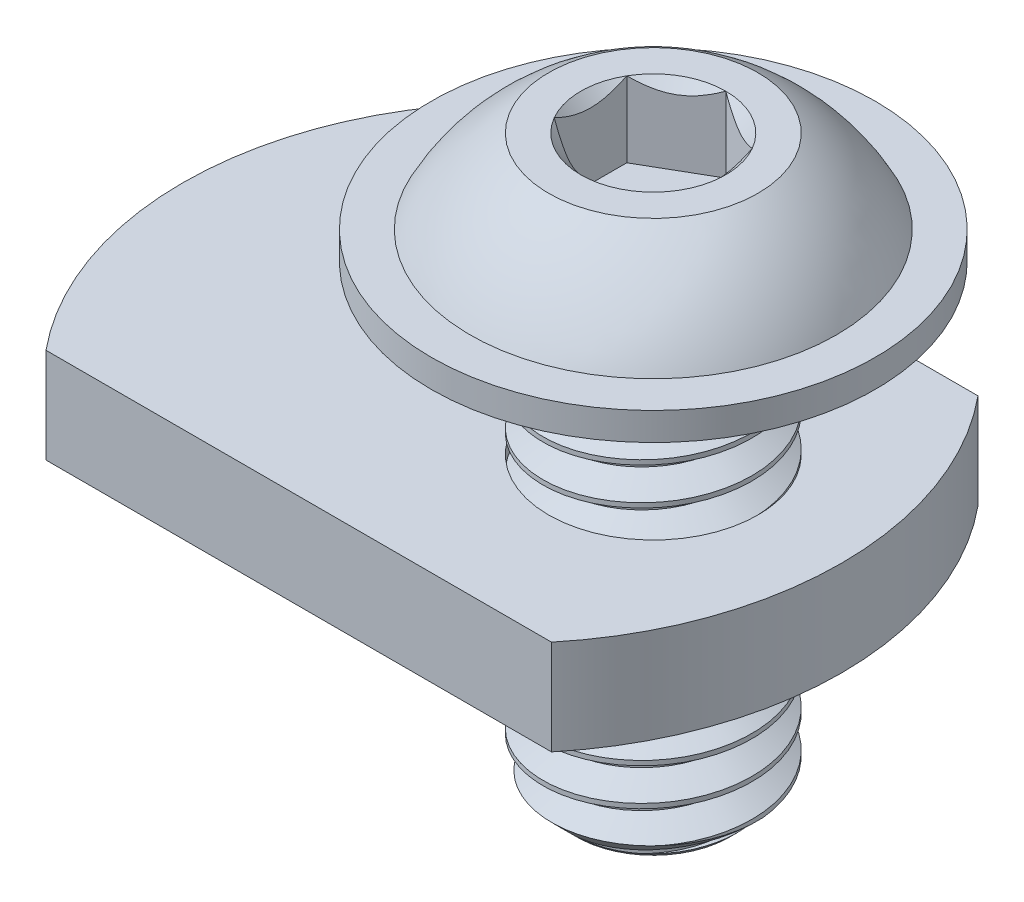
from build123d import *

# Parameters (mm, degrees)
SKETCH1_R           = 3.96875
BOSS_EXTRUDE1_DEPTH = 17.4625
CUT_SWEEP1_PITCH    = 1.411111111
SKETCH4_OUTSIDE_W   = 16.912
SKETCH4_OUTSIDE_H   = 16.912
SKETCH4_OUTSIDE_R   = 2.899449189
CUT_EXTRUDE1_DEPTH  = 1.411111111
CUT_EXTRUDE1_DRAFT  = -45
CUT_EXTRUDE2_DEPTH  = 2.8575
BOSS_EXTRUDE2_START = -6.35
SKETCH8_R           = 3.96875
BOSS_EXTRUDE2_DEPTH = 3.6068
SKETCH9_R           = 4.5593
SKETCH9_R_2         = 3.96875
BOSS_EXTRUDE3_DEPTH = 2.032


with BuildPart() as part:
    # Sketch1 → Boss-Extrude1 (new body)
    with BuildSketch(Plane(origin=(0, 0, 0), x_dir=(1, 0, 0), z_dir=(0, 1, 0))):
        with Locations(Location((0, 0, 0), (0, 0, 270))):
            Circle(SKETCH1_R)
    extrude(amount=-BOSS_EXTRUDE1_DEPTH)

    # Cut-Sweep1: the profile of Sketch3 screwed along a right-hand helix of 13.375 turns, 8 arcs to a turn; built about Z, then put on its axis
    cut_sweep1_z = Axis((0, 0, 0), (0, 0, 1))
    cut_sweep1_corners = [(3.052206448, 0, -0.529166667), (4.045128629, 0, 0.044097222), (4.045128629, 0, -1.278819444), (3.052206448, 0, -0.705555556)]
    with BuildLine(mode=Mode.PRIVATE) as cut_sweep1_profile:
        Line(cut_sweep1_corners[0], cut_sweep1_corners[1])
        Line(cut_sweep1_corners[1], cut_sweep1_corners[2])
        Line(cut_sweep1_corners[2], cut_sweep1_corners[3])
        Line(cut_sweep1_corners[3], cut_sweep1_corners[0])
    cut_sweep1_cap = Face(cut_sweep1_profile.wire())
    cut_sweep1_turn_angles = [0, 22.5, 45, 67.5, 90, 112.5, 135, 157.5, 180, 202.5, 225, 247.5, 270, 292.5, 315, 337.5, 360]
    cut_sweep1_turn_weights = [1, 0.9238795325112867, 1, 0.9238795325112867, 1, 0.9238795325112867, 1, 0.9238795325112867, 1, 0.9238795325112867, 1, 0.9238795325112867, 1, 0.9238795325112867, 1, 0.9238795325112867, 1]
    cut_sweep1_turn_rails = [Edge.make_bspline([Vector(p[0], p[1], 0).rotate(cut_sweep1_z, cut_sweep1_turn_angles[k]) / cut_sweep1_turn_weights[k] + Vector(0, 0, p[2] + CUT_SWEEP1_PITCH * cut_sweep1_turn_angles[k] / 360) for k in range(17)], [0, 0, 0, 1, 1, 2, 2, 3, 3, 4, 4, 5, 5, 6, 6, 7, 7, 8, 8, 8], 2, cut_sweep1_turn_weights) for p in cut_sweep1_corners]
    cut_sweep1_turn_sides = [Face.make_surface_from_curves(cut_sweep1_turn_rails[p[0]], cut_sweep1_turn_rails[p[1]]) for p in [(0, 1), (1, 2), (2, 3), (3, 0)]]
    cut_sweep1_last_angles = [4680, 4702.5, 4725, 4747.5, 4770, 4792.5, 4815]
    cut_sweep1_last_weights = [1, 0.9238795325112867, 1, 0.9238795325112867, 1, 0.9238795325112928, 1]
    cut_sweep1_last_rails = [Edge.make_bspline([Vector(p[0], p[1], 0).rotate(cut_sweep1_z, cut_sweep1_last_angles[k]) / cut_sweep1_last_weights[k] + Vector(0, 0, p[2] + CUT_SWEEP1_PITCH * cut_sweep1_last_angles[k] / 360) for k in range(7)], [0, 0, 0, 1, 1, 2, 2, 3, 3, 3], 2, cut_sweep1_last_weights) for p in cut_sweep1_corners]
    cut_sweep1_last_sides = [Face.make_surface_from_curves(cut_sweep1_last_rails[p[0]], cut_sweep1_last_rails[p[1]]) for p in [(0, 1), (1, 2), (2, 3), (3, 0)]]
    cut_sweep1 = Plane(origin=(0, -17.4625, 0), x_dir=(0, 0, -1), z_dir=(0, 1, 0)) * Solid(Shell([*[p.moved(Location((0, 0, CUT_SWEEP1_PITCH * i))) for i in range(13) for p in cut_sweep1_turn_sides], *cut_sweep1_last_sides, cut_sweep1_cap, cut_sweep1_cap.rotate(cut_sweep1_z, 4815).moved(Location((0, 0, CUT_SWEEP1_PITCH * 4815 / 360)))]))
    add(cut_sweep1, mode=Mode.SUBTRACT)


with BuildPart() as cut_extrude1_tool:
    # Sketch4 outside → Cut-Extrude1 (with draft: the straight prism first)
    with BuildSketch(Plane.XZ.offset(17.4625)):
        Rectangle(SKETCH4_OUTSIDE_W, SKETCH4_OUTSIDE_H)
        Circle(SKETCH4_OUTSIDE_R, mode=Mode.SUBTRACT)
    extrude(amount=-CUT_EXTRUDE1_DEPTH)
    # Cut-Extrude1: the draft: its side faces are tilted about the plane it starts from
    cut_extrude1_sides = [cut_extrude1_tool.faces().sort_by_distance(p)[0] for p in [
        (0, -16.756944444, -8.456),
        (8.456, -16.756944444, 0),
        (0, -16.756944444, 8.456),
        (-8.456, -16.756944444, 0),
        (-2.899449189, -16.756944444, 0),
    ]]
    draft(cut_extrude1_sides, Plane.XZ.offset(17.4625), CUT_EXTRUDE1_DRAFT)


with BuildPart() as part_1:
    add(part.part)

    # Cut-Extrude1: cut by cut_extrude1_tool
    add(cut_extrude1_tool.part, mode=Mode.SUBTRACT)

    # Sketch5 → Revolve1 (revolve)
    with BuildSketch(Plane.XY, mode=Mode.PRIVATE) as revolve1_sk:
        with BuildLine():
            Line((0, 0), (0, 4.2164))
            Line((0, 4.2164), (-3.96875, 4.2164))
            ThreePointArc((-3.96875, 4.2164), (-5.682243312, 2.846599775), (-6.9469, 1.0541))
            Line((-6.9469, 1.0541), (-8.4201, 1.0541))
            Line((-8.4201, 1.0541), (-8.4201, 0))
            Line((-8.4201, 0), (0, 0))
        make_face()
    revolve(revolve1_sk.sketch.rotate(Axis((0, 0, 0), (0, 1, 0)), 270), axis=Axis((0, 0, 0), (0, 1, 0)))

    # Sketch6 → Cut-Extrude2 (cut)
    with BuildSketch(Plane(origin=(0, 4.2164, 0), x_dir=(1, 0, 0), z_dir=(0, 1, 0))):
        Polygon((0, 2.749630657), (-2.38125, 1.374815329), (-2.38125, -1.374815329), (0, -2.749630657), (2.38125, -1.374815329), (2.38125, 1.374815329), align=None)
    extrude(amount=-CUT_EXTRUDE2_DEPTH, mode=Mode.SUBTRACT)

    # Cut-Extrude3 cone 1 section (through the dimple's axis) → Cut-Extrude3 (revolve, cut)
    with BuildSketch(Plane(origin=(0, 4.2164, 0), x_dir=(0, 0, 1), z_dir=(1, 0, 0))):
        Polygon((0, 0), (2.749630657, 0), (0, 2.749630657), align=None)
    revolve(axis=Axis((0, 4.2164, 0), (0, -1, 0)), mode=Mode.SUBTRACT)


with BuildPart() as body_2:
    # Sketch8 → Boss-Extrude2 (new body)
    with BuildSketch(Plane(origin=(0, 0, 0), x_dir=(1, 0, 0), z_dir=(0, 1, 0)).offset(BOSS_EXTRUDE2_START)):
        with BuildLine():
            Line((-14.946170275, 8.0899), (4.227370275, 8.0899))
            ThreePointArc((4.227370275, 8.0899), (7.1374, 0), (4.227370275, -8.0899))
            Line((4.227370275, -8.0899), (-14.946170275, -8.0899))
            ThreePointArc((-14.946170275, -8.0899), (-17.8562, 0), (-14.946170275, 8.0899))
        make_face()
        with Locations(Location((0, 0, 0), (0, 0, 270))):
            Circle(SKETCH8_R, mode=Mode.SUBTRACT)
    extrude(amount=-BOSS_EXTRUDE2_DEPTH)

    # Sketch9 → Boss-Extrude3 (add)
    with BuildSketch(Plane.XZ.offset(9.9568)):
        with Locations(Location((0, 0, 0), (0, 0, 90))):
            Circle(SKETCH9_R)
        with Locations(Location((0, 0, 0), (0, 0, 90))):
            Circle(SKETCH9_R_2, mode=Mode.SUBTRACT)
    extrude(amount=BOSS_EXTRUDE3_DEPTH)


solid = Compound([part_1.part, body_2.part])
